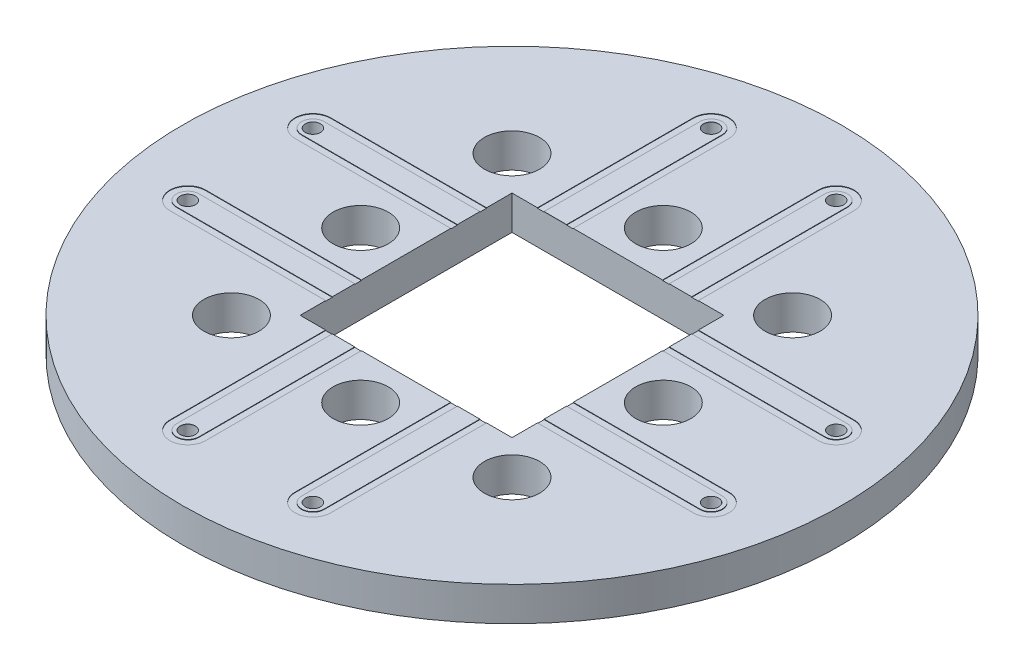
from build123d import *

# Parameters (mm, degrees)
BODY_SKETCH_R     = 12.446
BODY_DEPTH        = 1.27
COPPER_START      = 0.017500092
COPPER_SKETCH_R   = 12.446
COPPER_DEPTH      = 0.017500092
GAP_CUT_DEPTH     = 18.647060152
CENTER_DEPTH      = 0.017500092
IO_HOLE_SKETCH_R  = 0.287000061
IO_HOLE_DEPTH     = 18.647060152
GAP_CUTS_COUNT    = 4
CENTERS_COUNT     = 4
IO_HOLES_COUNT    = 4
POCKET_DEPTH      = 18.647060152
POCKET_DEPTH_BACK = 18.647060152
POCKET_SKETCH_W   = 8.000000002
POCKET_SKETCH_H   = 8.000000002
POSTS_R           = 1.0414
POST_CUT_DEPTH    = 18.647060152
POST_CUTS_COUNT   = 4


with BuildPart() as part:
    # Body Sketch → Body (new body)
    with BuildSketch(Plane(origin=(0, 0, 0), x_dir=(1, 0, 0), z_dir=(0, 1, 0))):
        Circle(BODY_SKETCH_R)
    extrude(amount=-BODY_DEPTH)

    # Copper Sketch → Copper (add)
    with BuildSketch(Plane(origin=(0, 0, 0), x_dir=(1, 0, 0), z_dir=(0, 1, 0)).offset(COPPER_START)):
        Circle(COPPER_SKETCH_R)
    extrude(amount=-COPPER_DEPTH)

    # Gap → Gap Cut (cut, through all)
    with BuildSketch(Plane(origin=(0, 0, 0), x_dir=(1, 0, 0), z_dir=(0, 1, 0))):
        with BuildLine():
            Line((-3.037200047, 9.881579386), (-3.037200047, -9.881579386))
            ThreePointArc((-3.037200047, -9.881579386), (-2.3622, -10.556579433), (-1.687199953, -9.881579386))
            Line((-1.687199953, -9.881579386), (-1.687199953, 9.881579386))
            ThreePointArc((-1.687199953, 9.881579386), (-2.3622, 10.556579433), (-3.037200047, 9.881579386))
        make_face()
    gap_cut = extrude(amount=GAP_CUT_DEPTH, mode=Mode.SUBTRACT)


with BuildPart() as body_2:
    # Center Sketch → Center (new body)
    with BuildSketch(Plane(origin=(0, 0, 0), x_dir=(1, 0, 0), z_dir=(0, 1, 0))):
        with BuildLine():
            Line((-2.787200039, 9.881579386), (-2.787200039, -9.881579386))
            ThreePointArc((-2.787200039, -9.881579386), (-2.3622, -10.306579425), (-1.937199961, -9.881579386))
            Line((-1.937199961, -9.881579386), (-1.937199961, 9.881579386))
            ThreePointArc((-1.937199961, 9.881579386), (-2.3622, 10.306579425), (-2.787200039, 9.881579386))
        make_face()
    center = extrude(amount=CENTER_DEPTH)


with BuildPart() as io_hole_tool:
    # IO Hole Sketch → IO Hole (new, symmetric)
    with BuildSketch(Plane(origin=(0, 0, 0), x_dir=(1, 0, 0), z_dir=(0, 1, 0))):
        with Locations((-2.3622, 9.881579386)):
            Circle(IO_HOLE_SKETCH_R)
        with Locations((-2.3622, -9.881579386)):
            Circle(IO_HOLE_SKETCH_R)
    io_hole = extrude(amount=IO_HOLE_DEPTH, both=True)


with BuildPart() as part_1:
    add(part.part)

    # IO Hole: cut by io_hole_tool
    add(io_hole_tool.part, mode=Mode.SUBTRACT)

    # Gap Cuts: Gap Cut ×4 about axis
    gap_cuts_axis = Axis((0, 0.0762, 0), (0, -1, 0))
    for i in range(1, GAP_CUTS_COUNT):
        add(gap_cut.rotate(gap_cuts_axis, i * 360 / GAP_CUTS_COUNT), mode=Mode.SUBTRACT)

    # Centers: Center ×4 about axis
    centers_axis = Axis((0, 0.0762, 0), (0, -1, 0))
    for i in range(1, CENTERS_COUNT):
        add(center.rotate(centers_axis, i * 360 / CENTERS_COUNT))

    # IO Holes: IO Hole ×4 about axis
    io_holes_axis = Axis((0, 0.0762, 0), (0, -1, 0))
    for i in range(1, IO_HOLES_COUNT):
        add(io_hole.rotate(io_holes_axis, i * 360 / IO_HOLES_COUNT), mode=Mode.SUBTRACT)


with BuildPart() as body_2_1:
    add(body_2.part)

    # IO Hole: cut by io_hole_tool
    add(io_hole_tool.part, mode=Mode.SUBTRACT)


with BuildPart() as pocket_tool:
    # Pocket Sketch → Pocket (new, two sides: drawn at the far end of the back side and taken through both)
    with BuildSketch(Plane(origin=(0, 0, 0), x_dir=(1, 0, 0), z_dir=(0, 1, 0)).offset(-POCKET_DEPTH_BACK)):
        Rectangle(POCKET_SKETCH_W, POCKET_SKETCH_H)
    extrude(amount=POCKET_DEPTH + POCKET_DEPTH_BACK)


with BuildPart() as part_2:
    add(part_1.part)

    # Pocket: cut by pocket_tool
    add(pocket_tool.part, mode=Mode.SUBTRACT)

    # Posts → Post Cut (cut, symmetric)
    with BuildSketch(Plane(origin=(0, 0, 0), x_dir=(1, 0, 0), z_dir=(0, 1, 0))):
        with Locations((0, 5.715)):
            Circle(POSTS_R)
        with Locations((-5.298351111, 5.298351111)):
            Circle(POSTS_R)
    post_cut = extrude(amount=POST_CUT_DEPTH, both=True, mode=Mode.SUBTRACT)

    # Post Cuts: Post Cut ×4 about axis
    post_cuts_axis = Axis((0, 0.0762, 0), (0, -1, 0))
    for i in range(1, POST_CUTS_COUNT):
        add(post_cut.rotate(post_cuts_axis, i * 360 / POST_CUTS_COUNT), mode=Mode.SUBTRACT)


with BuildPart() as body_2_2:
    add(body_2_1.part)

    # Pocket: cut by pocket_tool
    add(pocket_tool.part, mode=Mode.SUBTRACT)


solid = Compound([part_2.part, body_2_2.part])
